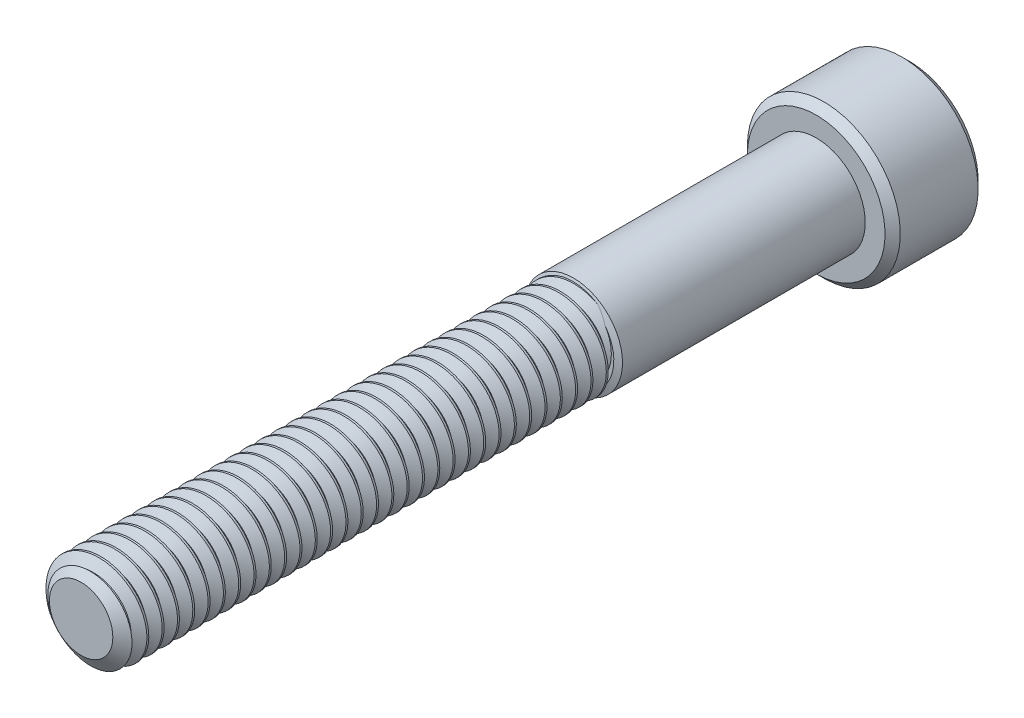
from build123d import *

# Parameters (mm, degrees)
SKETCH1_R          = 2.413
EXTRUDE1_DEPTH     = 38.1
CUT_SWEEP1_PITCH   = 0.79375
SKETCH6_R          = 3.9624
EXTRUDE2_DEPTH     = 4.826
CUT_EXTRUDE1_DEPTH = 2.9765625
CHAMFER1_SIZE      = 0.39624


with BuildPart() as part:
    # Sketch1 → Extrude1 (new body)
    with BuildSketch(Plane.XY):
        Circle(SKETCH1_R)
    extrude(amount=-EXTRUDE1_DEPTH)

    # Cut-Sweep1: arcs per turn and ends read off the stored shape
    # Cut-Sweep1: the profile of Sketch3 profile screwed along a right-hand helix through 51 turns, 6 arcs to a turn; built about Z, then put on its axis
    cut_sweep1_z = Axis((0, 0, 0), (0, 0, 1))
    cut_sweep1_corners = [(2.4133, 0, -1.488454455), (1.897444252, 0, -1.190625), (1.897444252, 0, -1.09140625), (2.4133, 0, -0.793576795)]
    with BuildLine(mode=Mode.PRIVATE) as cut_sweep1_profile:
        Line(cut_sweep1_corners[0], cut_sweep1_corners[1])
        Line(cut_sweep1_corners[1], cut_sweep1_corners[2])
        Line(cut_sweep1_corners[2], cut_sweep1_corners[3])
        Line(cut_sweep1_corners[3], cut_sweep1_corners[0])
    cut_sweep1_cap = Face(cut_sweep1_profile.wire())
    cut_sweep1_turn_angles = [0, 30, 60, 90, 120, 150, 180, 210, 240, 270, 300, 330, 360]
    cut_sweep1_turn_weights = [1, 0.8660254037844387, 1, 0.8660254037844387, 1, 0.8660254037844387, 1, 0.8660254037844387, 1, 0.8660254037844387, 1, 0.8660254037844387, 1]
    cut_sweep1_turn_rails = [Edge.make_bspline([Vector(p[0], p[1], 0).rotate(cut_sweep1_z, cut_sweep1_turn_angles[k]) / cut_sweep1_turn_weights[k] + Vector(0, 0, p[2] + CUT_SWEEP1_PITCH * cut_sweep1_turn_angles[k] / 360) for k in range(13)], [0, 0, 0, 1, 1, 2, 2, 3, 3, 4, 4, 5, 5, 6, 6, 6], 2, cut_sweep1_turn_weights) for p in cut_sweep1_corners]
    cut_sweep1_turn_sides = [Face.make_surface_from_curves(cut_sweep1_turn_rails[p[0]], cut_sweep1_turn_rails[p[1]]) for p in [(0, 1), (1, 2), (2, 3), (3, 0)]]
    cut_sweep1 = Plane(origin=(0, 0, 0), x_dir=(0, 1, 0), z_dir=(0, 0, -1)) * Solid(Shell([*[p.moved(Location((0, 0, CUT_SWEEP1_PITCH * i))) for i in range(51) for p in cut_sweep1_turn_sides], cut_sweep1_cap, cut_sweep1_cap.rotate(cut_sweep1_z, 18360).moved(Location((0, 0, CUT_SWEEP1_PITCH * 18360 / 360)))]))
    add(cut_sweep1, mode=Mode.SUBTRACT)

    # Sketch4 → Cut-Revolve1 (revolve, cut)
    with BuildSketch(Plane(origin=(0, 0, 0), x_dir=(0, 0, -1), z_dir=(1, 0, 0)), mode=Mode.PRIVATE) as cut_revolve1_sk:
        Polygon((0.538848736, 2.413), (0, 1.643444252), (0, 2.413), align=None)
    revolve(cut_revolve1_sk.sketch.rotate(Axis((0, 0, 0), (0, 0, -1)), 261.048315518), axis=Axis((0, 0, 0), (0, 0, -1)), mode=Mode.SUBTRACT)

    # Sketch5 → partially thread (revolve)
    with BuildSketch(Plane(origin=(0, 0, 0), x_dir=(0, 0, -1), z_dir=(1, 0, 0)), mode=Mode.PRIVATE) as partially_thread_sk:
        Polygon((38.1, 2.54), (25.520182971, 2.54), (25.4, 2.2098), (25.4, 0), (38.1, 0), align=None)
    revolve(partially_thread_sk.sketch.rotate(Axis((0, 0, 0), (0, 0, -1)), 262.136702753), axis=Axis((0, 0, 0), (0, 0, -1)))

    # Sketch6 → Extrude2 (add)
    with BuildSketch(Plane(origin=(0, 0, -38.1), x_dir=(-1, 0, 0), z_dir=(0, 0, -1))):
        Circle(SKETCH6_R)
    extrude(amount=EXTRUDE2_DEPTH)

    # Sketch7 → Cut-Extrude1 (cut)
    with BuildSketch(Plane(origin=(0, 0, -42.926), x_dir=(-1, 0, 0), z_dir=(0, 0, -1))):
        Polygon((0, 2.291358881), (-1.984375, 1.14567944), (-1.984375, -1.14567944), (0, -2.291358881), (1.984375, -1.14567944), (1.984375, 1.14567944), align=None)
    extrude(amount=-CUT_EXTRUDE1_DEPTH, mode=Mode.SUBTRACT)

    # Cut-Extrude2 cone 1 section (through the dimple's axis) → Cut-Extrude2 (revolve, cut)
    with BuildSketch(Plane(origin=(0, 0, -42.926), x_dir=(0, 1, 0), z_dir=(1, 0, 0))):
        Polygon((0, 0), (2.291358881, 0), (0, 2.291358881), align=None)
    revolve(axis=Axis((0, 0, -42.926), (0, 0, 1)), mode=Mode.SUBTRACT)

    # Chamfer1
    chamfer1_edges = [part.edges().sort_by_distance(p)[0] for p in [
        (3.9624, 0, -38.1),
        (3.9624, 0, -42.926),
    ]]
    chamfer(chamfer1_edges, length=CHAMFER1_SIZE)


solid = part.part
